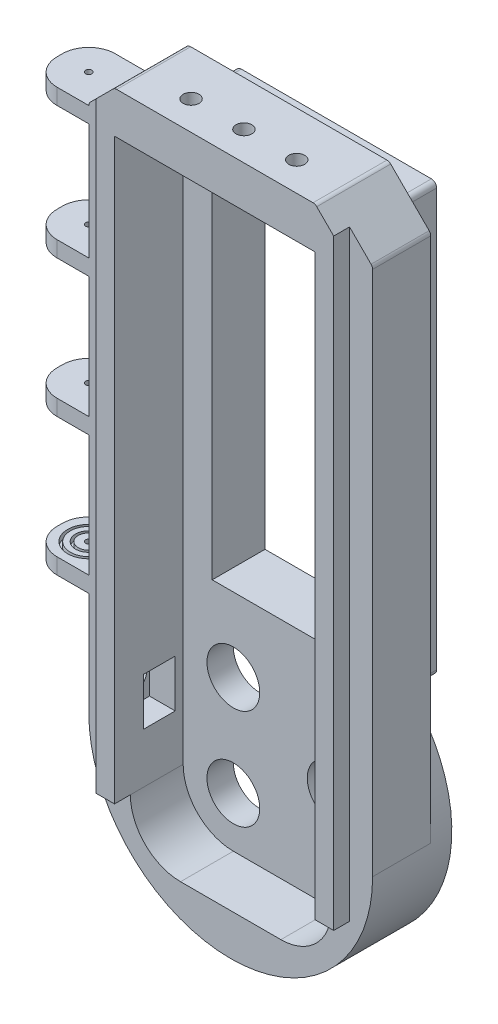
from build123d import *
from build123d.topology import SkipClean

# Parameters (mm, degrees)
CROQUIS1_W               = 27
CROQUIS1_H               = 72
CROQUIS1_R               = 5
SALIENTE_EXTRUIR1_DEPTH  = 5
CROQUIS2_W               = 38
CROQUIS2_H               = 81
CROQUIS2_W_2             = 27
CROQUIS2_H_2             = 72
SALIENTE_EXTRUIR2_DEPTH  = 5
SALIENTE_EXTRUIR9_START  = -1
SALIENTE_EXTRUIR9_DEPTH  = 1
SALIENTE_EXTRUIR10_DEPTH = 11
SALIENTE_EXTRUIR11_DEPTH = 10
REDONDEO1_R              = 1
REDONDEO2_R              = 1
REDONDEO3_R              = 1
CROQUIS6_W               = 6
CROQUIS6_H               = 9
CORTAR_EXTRUIR1_DEPTH    = 8
CROQUIS7_W               = 6
CROQUIS7_H               = 9
CROQUIS7_R               = 2.5
SALIENTE_EXTRUIR12_DEPTH = 3
CROQUIS8_W               = 11
CROQUIS8_H               = 3
SALIENTE_EXTRUIR13_DEPTH = 11
REDONDEO4_R              = 5
CROQUIS9_R               = 0.6
CORTAR_EXTRUIR2_DEPTH    = 80
SALIENTE_EXTRUIR14_START = -2
CROQUIS10_R              = 0.6
SALIENTE_EXTRUIR14_DEPTH = 2
CROQUIS11_R              = 4
CROQUIS11_R_2            = 3.5
CROQUIS11_R_3            = 2.5
CROQUIS11_R_4            = 2
CORTAR_EXTRUIR3_DEPTH    = 1
SALIENTE_EXTRUIR15_DEPTH = 3
CROQUIS15_R              = 1.5
CORTAR_EXTRUIR5_DEPTH    = 5


with BuildPart() as part:
    # Croquis1 → Saliente-Extruir1 (new body)
    with BuildSketch(Plane.XY):
        with BuildLine():
            Line((-19, 40.5), (-19, -40.5))
            ThreePointArc((-19, -40.5), (0, -86.370057685), (19, -40.5))
            Line((19, -40.5), (19, 40.5))
            Line((19, 40.5), (-19, 40.5))
        make_face()
        Rectangle(CROQUIS1_W, CROQUIS1_H, mode=Mode.SUBTRACT)
        with Locations((9.5, -59.5)):
            Circle(CROQUIS1_R, mode=Mode.SUBTRACT)
        with Locations((-9.5, -69)):
            Circle(CROQUIS1_R, mode=Mode.SUBTRACT)
        with Locations((-9.5, -50)):
            Circle(CROQUIS1_R, mode=Mode.SUBTRACT)
    extrude(amount=SALIENTE_EXTRUIR1_DEPTH)

    # Croquis2 → Saliente-Extruir2 (add)
    with BuildSketch(Plane(origin=(0, 0, 0), x_dir=(-1, 0, 0), z_dir=(0, 0, -1))):
        Rectangle(CROQUIS2_W, CROQUIS2_H)
        Rectangle(CROQUIS2_W_2, CROQUIS2_H_2, mode=Mode.SUBTRACT)
    extrude(amount=SALIENTE_EXTRUIR2_DEPTH)

    # Croquis3 → Saliente-Extruir9 (add)
    with BuildSketch(Plane.XY.offset(5).offset(SALIENTE_EXTRUIR9_START)):
        with BuildLine():
            Line((26.870057685, -59.5), (26.870057685, 40.5))
            Line((26.870057685, 40.5), (19, 48.370057685))
            Line((19, 48.370057685), (-19, 48.370057685))
            Line((-19, 48.370057685), (-26.870057685, 40.5))
            Line((-26.870057685, 40.5), (-26.870057685, -59.5))
            ThreePointArc((-26.870057685, -59.5), (0, -86.370057685), (26.870057685, -59.5))
        make_face()
        with BuildLine():
            Line((19, -59.5), (19, 40.5))
            Line((19, 40.5), (-19, 40.5))
            Line((-19, 40.5), (-19, -59.5))
            ThreePointArc((-19, -59.5), (0, -78.5), (19, -59.5))
        make_face(mode=Mode.SUBTRACT)
    extrude(amount=SALIENTE_EXTRUIR9_DEPTH)

    # Croquis4 → Saliente-Extruir10 (add)
    with BuildSketch(Plane(origin=(0, 0, 4), x_dir=(-1, 0, 0), z_dir=(0, 0, -1))):
        with BuildLine():
            Line((-19, -40.5), (-19, 40.5))
            Line((-19, 40.5), (19, 40.5))
            Line((19, 40.5), (19, -40.5))
            ThreePointArc((19, -40.5), (24.824696333, -49.217274097), (26.870057685, -59.5))
            Line((26.870057685, -59.5), (26.870057685, 40.5))
            Line((26.870057685, 40.5), (19, 48.370057685))
            Line((19, 48.370057685), (-19, 48.370057685))
            Line((-19, 48.370057685), (-26.870057685, 40.5))
            Line((-26.870057685, 40.5), (-26.870057685, -59.5))
            ThreePointArc((-26.870057685, -59.5), (-24.824696333, -49.217274097), (-19, -40.5))
        make_face()
    extrude(amount=-SALIENTE_EXTRUIR10_DEPTH)

    # Croquis5 → Saliente-Extruir11 (add)
    with SkipClean():  # the faces are left unmerged after this step: merging them gives an invalid solid
        with BuildSketch(Plane.XY.offset(5)):
            with BuildLine():
                Line((-19, -59.5), (-19, -69))
                ThreePointArc((-19, -69), (-16.217514421, -75.717514421), (-9.5, -78.5))
                Line((-9.5, -78.5), (9.5, -78.5))
                ThreePointArc((9.5, -78.5), (16.217514421, -75.717514421), (19, -69))
                Line((19, -69), (19, -59.5))
                Line((19, -59.5), (19, -40.5))
                ThreePointArc((19, -40.5), (0, -86.370057685), (-19, -40.5))
                Line((-19, -40.5), (-19, -59.5))
            make_face()
        extrude(amount=SALIENTE_EXTRUIR11_DEPTH)

    # Redondeo1
    redondeo1_edges = [part.edges().sort_by_distance(p)[0] for p in [
        (-19, -40.5, -2.5),
        (-19, 40.5, -0.5),
        (19, 40.5, -0.5),
        (19, -40.5, -2.5),
    ]]
    fillet(redondeo1_edges, radius=REDONDEO1_R)

    # Redondeo2
    redondeo2_edges = [part.edges().sort_by_distance(p)[0] for p in [
        (-18.707106781, 40.207106781, 4),
        (18.707106781, 40.207106781, 4),
        (-19, -0.5, 4),
        (0, 40.5, 4),
        (19, -0.5, 4),
    ]]
    fillet(redondeo2_edges, radius=REDONDEO2_R)

    # Redondeo3
    redondeo3_edges = [part.edges().sort_by_distance(p)[0] for p in [
        (-26.870057685, 40.5, 9.5),
        (-19, 48.370057685, 9.5),
        (26.870057685, 40.5, 9.5),
        (19, 48.370057685, 9.5),
    ]]
    fillet(redondeo3_edges, radius=REDONDEO3_R)

    # Croquis6 → Cortar-Extruir1 (cut)
    with SkipClean():  # the faces are left unmerged after this step: merging them gives an invalid solid
        with BuildSketch(Plane.ZY.offset(26.870057685)):
            with Locations((9.5, -55)):
                Rectangle(CROQUIS6_W, CROQUIS6_H)
        extrude(amount=-CORTAR_EXTRUIR1_DEPTH, mode=Mode.SUBTRACT)

    # Croquis7 → Saliente-Extruir12 (add)
    with SkipClean():  # the faces are left unmerged after this step: merging them gives an invalid solid
        with BuildSketch(Plane.ZY.offset(26.870057685)):
            with Locations((9.5, -55)):
                Rectangle(CROQUIS7_W, CROQUIS7_H)
            with Locations((9.5, -55)):
                Circle(CROQUIS7_R, mode=Mode.SUBTRACT)
        extrude(amount=-SALIENTE_EXTRUIR12_DEPTH)

    # Croquis8 → Saliente-Extruir13 (add)
    with SkipClean():  # the faces are left unmerged after this step: merging them gives an invalid solid
        with BuildSketch(Plane.ZY.offset(26.870057685)):
            with Locations((9.5, 38.585786438)):
                Rectangle(CROQUIS8_W, CROQUIS8_H)
            with Locations((9.5, 13.585786438)):
                Rectangle(CROQUIS8_W, CROQUIS8_H)
            with Locations((9.5, -12.414213562)):
                Rectangle(CROQUIS8_W, CROQUIS8_H)
            with Locations((9.5, -38.414213562)):
                Rectangle(CROQUIS8_W, CROQUIS8_H)
        extrude(amount=SALIENTE_EXTRUIR13_DEPTH)

    # Redondeo4
    redondeo4_edges = [part.edges().sort_by_distance(p)[0] for p in [
        (-37.870057685, -38.414213562, 4),
        (-37.870057685, -38.414213562, 15),
        (-37.870057685, -12.414213562, 4),
        (-37.870057685, -12.414213562, 15),
        (-37.870057685, 13.585786438, 4),
        (-37.870057685, 13.585786438, 15),
        (-37.870057685, 38.585786438, 4),
        (-37.870057685, 38.585786438, 15),
    ]]
    fillet(redondeo4_edges, radius=REDONDEO4_R)

    # Croquis9 → Cortar-Extruir2 (cut)
    with SkipClean():  # the faces are left unmerged after this step: merging them gives an invalid solid
        with BuildSketch(Plane(origin=(0, 40.085786438, 0), x_dir=(1, 0, 0), z_dir=(0, 1, 0))):
            with Locations((-32.370057685, -9.5)):
                Circle(CROQUIS9_R)
        extrude(amount=-CORTAR_EXTRUIR2_DEPTH, mode=Mode.SUBTRACT)

    # Croquis10 → Saliente-Extruir14 (add)
    with SkipClean():  # the faces are left unmerged after this step: merging them gives an invalid solid
        with BuildSketch(Plane.XZ.offset(39.914213562).offset(SALIENTE_EXTRUIR14_START)):
            with Locations((-32.370057685, 9.5)):
                Circle(CROQUIS10_R)
        extrude(amount=SALIENTE_EXTRUIR14_DEPTH)

    # Croquis11 → Cortar-Extruir3 (cut)
    # profile 1 of 2: a face of its own
    with SkipClean():  # the faces are left unmerged after this step: merging them gives an invalid solid
        with BuildSketch(Plane(origin=(0, -36.914213562, 0), x_dir=(1, 0, 0), z_dir=(0, 1, 0))):
            with Locations((-32.370057685, -9.5)):
                Circle(CROQUIS11_R)
            with Locations((-32.370057685, -9.5)):
                Circle(CROQUIS11_R_2, mode=Mode.SUBTRACT)
        # profile 2 of 2: a face of its own
        with BuildSketch(Plane(origin=(0, -36.914213562, 0), x_dir=(1, 0, 0), z_dir=(0, 1, 0))):
            with Locations((-32.370057685, -9.5)):
                Circle(CROQUIS11_R_3)
            with Locations((-32.370057685, -9.5)):
                Circle(CROQUIS11_R_4, mode=Mode.SUBTRACT)
        extrude(amount=-CORTAR_EXTRUIR3_DEPTH, mode=Mode.SUBTRACT)

    # Croquis13 → Saliente-Extruir15 (add)
    with SkipClean():  # the faces are left unmerged after this step: merging them gives an invalid solid
        with BuildSketch(Plane.XY.offset(15)):
            with BuildLine():
                Line((-19, 40.5), (19, 40.5))
                Line((19, 40.5), (19, -69))
                Line((19, -69), (22.5, -69))
                Line((22.5, -69), (22.5, 44.870057685))
                Line((22.5, 44.870057685), (19.292893219, 48.077164466))
                ThreePointArc((19.292893219, 48.077164466), (18.96846987, 48.293937218), (18.585786438, 48.370057685))
                Line((18.585786438, 48.370057685), (-18.585786438, 48.370057685))
                ThreePointArc((-18.585786438, 48.370057685), (-18.96846987, 48.293937218), (-19.292893219, 48.077164466))
                Line((-19.292893219, 48.077164466), (-22.5, 44.870057685))
                Line((-22.5, 44.870057685), (-22.5, -69))
                Line((-22.5, -69), (-19, -69))
                Line((-19, -69), (-19, 40.5))
            make_face()
        extrude(amount=SALIENTE_EXTRUIR15_DEPTH)

    # Croquis15 → Cortar-Extruir5 (cut)
    with SkipClean():  # the faces are left unmerged after this step: merging them gives an invalid solid
        with BuildSketch(Plane(origin=(0, 48.370057685, 0), x_dir=(1, 0, 0), z_dir=(0, 1, 0))):
            with Locations((0, -12.5)):
                Circle(CROQUIS15_R)
            with Locations((-10, -12.5)):
                Circle(CROQUIS15_R)
            with Locations((10, -12.5)):
                Circle(CROQUIS15_R)
        extrude(amount=-CORTAR_EXTRUIR5_DEPTH, mode=Mode.SUBTRACT)


solid = part.part
